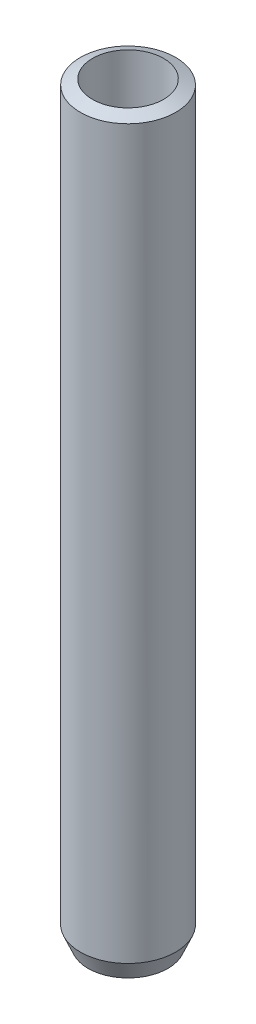
from build123d import *

# Parameters (mm, degrees)
SKETCH1_R           = 30
BOSS_EXTRUDE1_DEPTH = 473.87345
SKETCH2_R           = 22.383213975
CUT_EXTRUDE1_DEPTH  = 476.768900428
CHAMFER1_SIZE       = 4.873881
CHAMFER1_SIZE_2     = 11.35793


with BuildPart() as part:
    # Sketch1 → Boss-Extrude1 (new body)
    with BuildSketch(Plane(origin=(0, 0, 0), x_dir=(1, 0, 0), z_dir=(0, 1, 0))):
        with Locations(Location((0, 0, 0), (0, 0, 90))):
            Circle(SKETCH1_R)
    extrude(amount=BOSS_EXTRUDE1_DEPTH)

    # Sketch2 → Cut-Extrude1 (cut, through all)
    with BuildSketch(Plane(origin=(0, 0, 0), x_dir=(1, 0, 0), z_dir=(0, 1, 0))):
        with Locations(Location((0, 0, 0), (0, 0, 90))):
            Circle(SKETCH2_R)
    extrude(amount=CUT_EXTRUDE1_DEPTH, mode=Mode.SUBTRACT)

    # Chamfer1
    # the kernel refuses this chamfer: 11.35793, 4.873881 mm, written as the material it takes off along each edge
    with BuildSketch(Plane(origin=(0, 473.87345, 0), x_dir=(0, 0, -1), z_dir=(1, 0, 0))) as chamfer1_piece_1:
        Polygon((30, -CHAMFER1_SIZE), (30 - CHAMFER1_SIZE_2, 0), (30, 0), align=None)
    revolve(axis=Axis((0, 473.87345, 0), (0, 1, 0)), mode=Mode.SUBTRACT)
    with BuildSketch(Plane(origin=(0, 0, 0), x_dir=(0, 0, -1), z_dir=(1, 0, 0))) as chamfer1_piece_2:
        Polygon((30, CHAMFER1_SIZE_2), (30 - CHAMFER1_SIZE, 0), (30, 0), align=None)
    revolve(axis=Axis((0, 0, 0), (0, 1, 0)), mode=Mode.SUBTRACT)


solid = part.part
